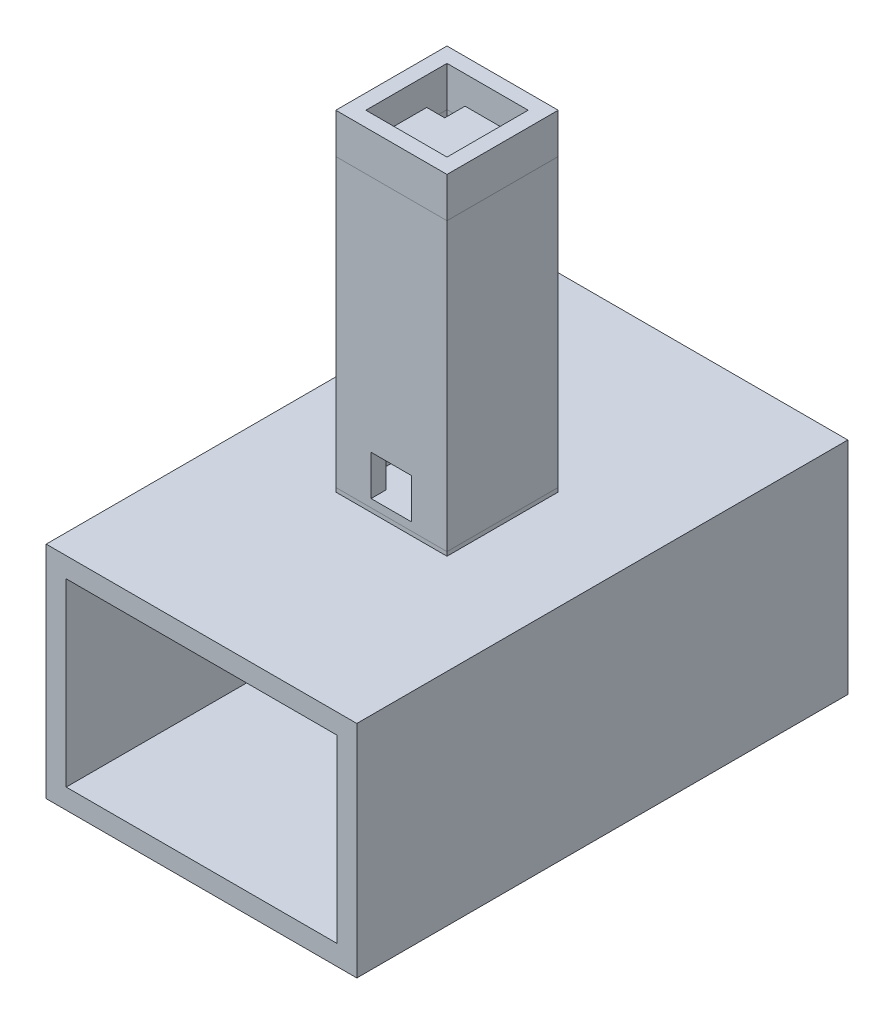
from build123d import *

# Parameters (mm, degrees)
SKETCH1_W            = 31
SKETCH1_H            = 22
BOSS_EXTRUDE1_DEPTH  = 2
BOSS_EXTRUDE2_START  = 2
SKETCH1_3_W          = 31
SKETCH1_3_H          = 22
SKETCH1_3_W_2        = 27
SKETCH1_3_H_2        = 18
BOSS_EXTRUDE2_DEPTH  = 47
SKETCH2_W            = 11.1
SKETCH2_H            = 11.1
SKETCH2_W_2          = 8.1
SKETCH2_H_2          = 8.1
BOSS_EXTRUDE3_DEPTH  = 33
SKETCH2_7_W          = 11.1
SKETCH2_7_H          = 11.1
BOSS_EXTRUDE6_DEPTH  = 1.2
SKETCH3_W            = 4.05
SKETCH3_H            = 4
CUT_EXTRUDE1_DEPTH   = 1.5
BOSS_EXTRUDE4_START  = 30.2
BOSS_EXTRUDE4_DEPTH  = 1.2
SPLIT2_START         = 22.4
SPLIT2_OUTLINE_W     = 11.1
SPLIT2_OUTLINE_H     = 11.1
SPLIT2_DEPTH         = 32.6
SPLIT2_2_DEPTH       = 28.6
SPLIT2_START_2       = 27.2
SPLIT2_3_OUTLINE_W   = 4.05
SPLIT2_3_OUTLINE_H   = 1.5
SPLIT2_3_DEPTH       = 23.8
SPLIT2_4_DEPTH       = 0.8
SPLIT2_START_3       = 51
SPLIT2_5_OUTLINE_W   = 11.1
SPLIT2_5_OUTLINE_H   = 11.1
SPLIT2_5_OUTLINE_W_2 = 8.1
SPLIT2_5_OUTLINE_H_2 = 8.1
SPLIT2_5_DEPTH       = 4
SPLIT2_6_DEPTH       = 1.2


# Read off the part's stored shape, not the designer's step: Split2
with BuildPart() as part:
    # Sketch1 → Boss-Extrude1 (new body)
    with BuildSketch(Plane.XY):
        with Locations((15.5, 11)):
            Rectangle(SKETCH1_W, SKETCH1_H)
    extrude(amount=BOSS_EXTRUDE1_DEPTH)

    # Sketch1<3> → Boss-Extrude2 (add)
    with BuildSketch(Plane.XY.offset(BOSS_EXTRUDE2_START)):
        with Locations((15.5, 11)):
            Rectangle(SKETCH1_3_W, SKETCH1_3_H)
        with Locations((15.5, 11)):
            Rectangle(SKETCH1_3_W_2, SKETCH1_3_H_2, mode=Mode.SUBTRACT)
    extrude(amount=BOSS_EXTRUDE2_DEPTH)

    # Sketch2 → Boss-Extrude3 (add)
    with BuildSketch(Plane(origin=(0, 22, 0), x_dir=(1, 0, 0), z_dir=(0, 1, 0))):
        with Locations((15.5, -24.5)):
            Rectangle(SKETCH2_W, SKETCH2_H)
        with Locations((15.5, -24.5)):
            Rectangle(SKETCH2_W_2, SKETCH2_H_2, mode=Mode.SUBTRACT)
    extrude(amount=BOSS_EXTRUDE3_DEPTH)

    # Sketch2<7> → Boss-Extrude6 (add)
    with BuildSketch(Plane(origin=(0, 22, 0), x_dir=(1, 0, 0), z_dir=(0, 1, 0))):
        with Locations((15.5, -24.5)):
            Rectangle(SKETCH2_7_W, SKETCH2_7_H)
    extrude(amount=BOSS_EXTRUDE6_DEPTH)

    # Sketch3 → Cut-Extrude1 (cut)
    with BuildSketch(Plane.XY.offset(30.05)):
        with Locations((15.5, 25.2)):
            Rectangle(SKETCH3_W, SKETCH3_H)
    extrude(amount=-CUT_EXTRUDE1_DEPTH, mode=Mode.SUBTRACT)

    # Sketch2<5> → Boss-Extrude4 (add)
    with BuildSketch(Plane(origin=(0, 22, 0), x_dir=(1, 0, 0), z_dir=(0, 1, 0)).offset(BOSS_EXTRUDE4_START)):
        Polygon((13.25, -26.525), (13.25, -28.55), (17.75, -28.55), (17.75, -26.525), (19.55, -26.525), (19.55, -22.475), (17.75, -22.475), (17.75, -20.45), (13.25, -20.45), (13.25, -22.475), (11.45, -22.475), (11.45, -26.525), align=None)
    extrude(amount=-BOSS_EXTRUDE4_DEPTH)

    # Split2 outline → Split2 (cut)
    with BuildSketch(Plane(origin=(0, 0, 0), x_dir=(1, 0, 0), z_dir=(0, 1, 0)).offset(SPLIT2_START)):
        with Locations((15.5, -24.5)):
            Rectangle(SPLIT2_OUTLINE_W, SPLIT2_OUTLINE_H)
    extrude(amount=SPLIT2_DEPTH, mode=Mode.SUBTRACT)


with BuildPart() as body_2:
    # Split2 2 outline → Split2 2 (new body)
    with BuildSketch(Plane(origin=(0, 0, 0), x_dir=(1, 0, 0), z_dir=(0, 1, 0)).offset(SPLIT2_START)):
        Polygon((11.45, -20.45), (19.55, -20.45), (19.55, -28.55), (17.525, -28.55), (17.525, -30.05), (21.05, -30.05), (21.05, -18.95), (9.95, -18.95), (9.95, -30.05), (13.475, -30.05), (13.475, -28.55), (11.45, -28.55), align=None)
    extrude(amount=SPLIT2_2_DEPTH)

    # Split2 3 outline → Split2 3 (add)
    with BuildSketch(Plane(origin=(0, 0, 0), x_dir=(1, 0, 0), z_dir=(0, 1, 0)).offset(SPLIT2_START_2)):
        with Locations((15.5, -29.3)):
            Rectangle(SPLIT2_3_OUTLINE_W, SPLIT2_3_OUTLINE_H)
    extrude(amount=SPLIT2_3_DEPTH)

    # Split2 4 outline → Split2 4 (add)
    with BuildSketch(Plane(origin=(0, 0, 0), x_dir=(1, 0, 0), z_dir=(0, 1, 0)).offset(SPLIT2_START)):
        Polygon((19.55, -28.55), (19.55, -20.45), (11.45, -20.45), (11.45, -28.55), (13.475, -28.55), (13.475, -30.05), (17.525, -30.05), (17.525, -28.55), align=None)
    extrude(amount=SPLIT2_4_DEPTH)


with BuildPart() as body_3:
    # Split2 5 outline → Split2 5 (new body)
    with BuildSketch(Plane(origin=(0, 0, 0), x_dir=(1, 0, 0), z_dir=(0, 1, 0)).offset(SPLIT2_START_3)):
        with Locations((15.5, -24.5)):
            Rectangle(SPLIT2_5_OUTLINE_W, SPLIT2_5_OUTLINE_H)
        with Locations((15.5, -24.5)):
            Rectangle(SPLIT2_5_OUTLINE_W_2, SPLIT2_5_OUTLINE_H_2, mode=Mode.SUBTRACT)
    extrude(amount=SPLIT2_5_DEPTH)

    # Split2 6 outline → Split2 6 (add)
    with BuildSketch(Plane(origin=(0, 0, 0), x_dir=(1, 0, 0), z_dir=(0, 1, 0)).offset(SPLIT2_START_3)):
        Polygon((13.25, -22.475), (11.45, -22.475), (11.45, -26.525), (13.25, -26.525), (13.25, -28.55), (17.75, -28.55), (17.75, -26.525), (19.55, -26.525), (19.55, -22.475), (17.75, -22.475), (17.75, -20.45), (13.25, -20.45), align=None)
    extrude(amount=SPLIT2_6_DEPTH)


solid = Compound([part.part, body_2.part, body_3.part])
